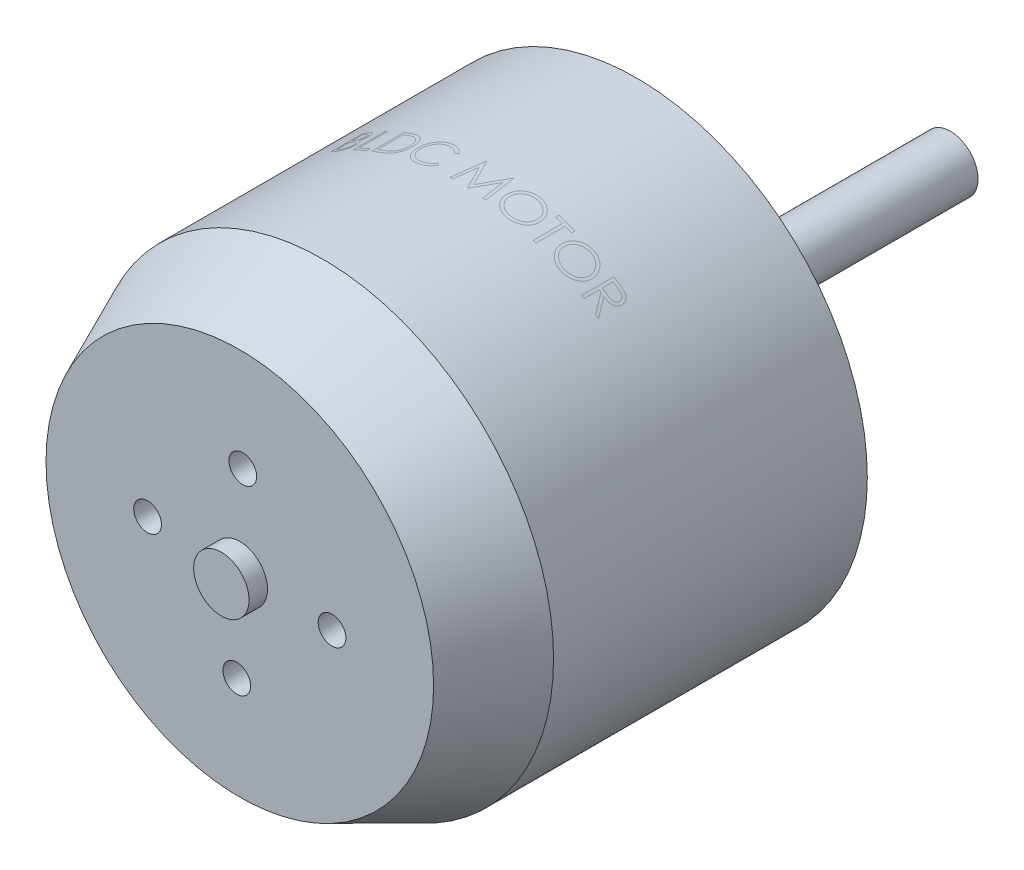
from build123d import *

# Parameters (mm, degrees)
SKETCH1_W                    = 25
SKETCH1_H                    = 43
SKETCH2_R                    = 3
BOSS_EXTRUDE1_DEPTH          = 2
BOSS_EXTRUDE2_START          = 34
SKETCH3_R                    = 3
BOSS_EXTRUDE2_DEPTH          = 34
F_3_0_3_DIAMETER_HOLE1_D     = 3
F_3_0_3_DIAMETER_HOLE1_DEPTH = 6
CHAMFER1_SIZE                = 4
CHAMFER1_SIZE2               = 9


with BuildPart() as part:
    # Sketch1 → Revolve1 (revolve)
    with BuildSketch(Plane(origin=(0, 0, 0), x_dir=(1, 0, 0), z_dir=(0, 1, 0))):
        with Locations((-1.767778742, -3.566836924)):
            Rectangle(SKETCH1_W, SKETCH1_H)
    revolve(axis=Axis((-14.267778742, 0, -17.933163076), (0, 0, 1)))

    # Sketch2 → Boss-Extrude1 (add)
    with BuildSketch(Plane.XY.offset(25.066836924)):
        with Locations((-14.267778742, 0)):
            Circle(SKETCH2_R)
    extrude(amount=BOSS_EXTRUDE1_DEPTH)

    # Sketch3 → Boss-Extrude2 (add)
    with BuildSketch(Plane(origin=(0, 0, -17.933163076), x_dir=(-1, 0, 0), z_dir=(0, 0, -1)).offset(BOSS_EXTRUDE2_START)):
        with Locations((14.267778742, 0)):
            Circle(SKETCH3_R)
    extrude(amount=-BOSS_EXTRUDE2_DEPTH)

    # Ø3.0 (3) Diameter Hole1
    with Locations(Plane.XY.offset(25.066836924)):
        with Locations((-24.262440634, 0.326701167), (-14.594479909, -9.994661893), (-13.941077575, 9.994661893), (-4.273116849, -0.326701167)):
            Hole(F_3_0_3_DIAMETER_HOLE1_D / 2, depth=F_3_0_3_DIAMETER_HOLE1_DEPTH)

    # Chamfer1
    chamfer1_edges = [part.edges().sort_by_distance(p)[0] for p in [
        (-39.267778742, 0, 25.066836924),
    ]]
    chamfer1_side = [part.faces().sort_by_distance(p)[0] for p in [
        (-38.560671961, 0, 25.066836924),
    ]]
    chamfer(chamfer1_edges, length=CHAMFER1_SIZE, length2=CHAMFER1_SIZE2, reference=chamfer1_side[0])


solid = part.part
